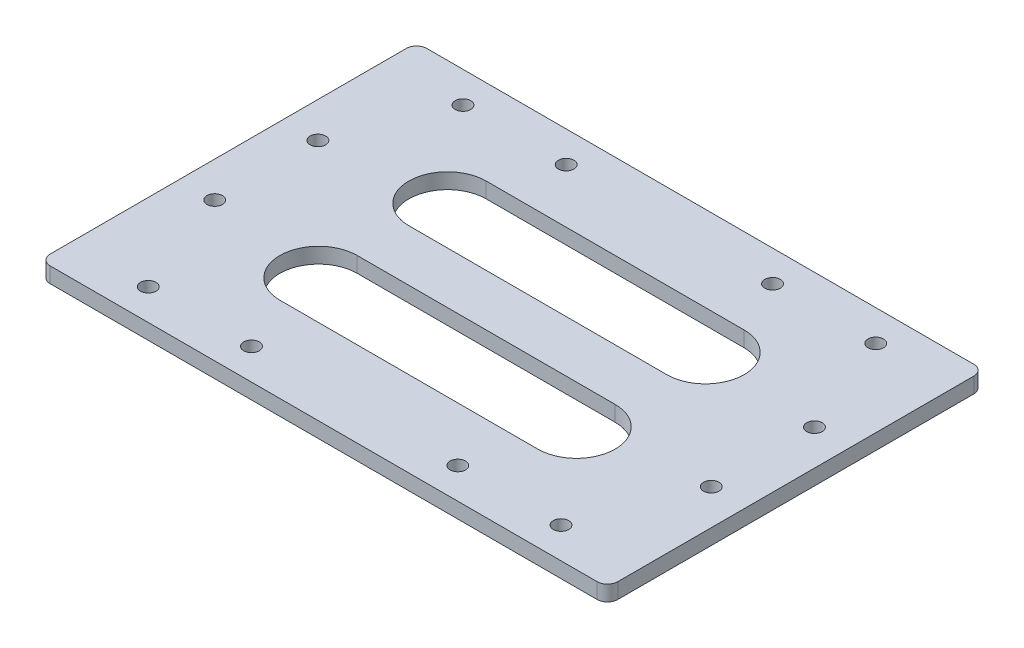
from build123d import *

# Parameters (mm, degrees)
SKETCH_1_W          = 110
SKETCH_1_H          = 73
SKETCH_1_R          = 1.5
EXTRUDE_1_DEPTH     = 3
CUT_EXTRUDE_1_DEPTH = 10
FILLET_1_R          = 2


with BuildPart() as part:
    # 草图1 → 凸台-拉伸1 (new body)
    with BuildSketch(Plane(origin=(0, 0, 0), x_dir=(1, 0, 0), z_dir=(0, 1, 0))):
        Rectangle(SKETCH_1_W, SKETCH_1_H)
        with Locations((-40, 30.5)):
            Circle(SKETCH_1_R, mode=Mode.SUBTRACT)
        with Locations((-20, 30.5)):
            Circle(SKETCH_1_R, mode=Mode.SUBTRACT)
        with Locations((-48.125, 10.5)):
            Circle(SKETCH_1_R, mode=Mode.SUBTRACT)
        with Locations((-48.125, -9.5)):
            Circle(SKETCH_1_R, mode=Mode.SUBTRACT)
        with Locations((48.125, -9.5)):
            Circle(SKETCH_1_R, mode=Mode.SUBTRACT)
        with Locations((48.125, 10.5)):
            Circle(SKETCH_1_R, mode=Mode.SUBTRACT)
        with Locations((20, 30.5)):
            Circle(SKETCH_1_R, mode=Mode.SUBTRACT)
        with Locations((40, 30.5)):
            Circle(SKETCH_1_R, mode=Mode.SUBTRACT)
        with Locations((40, -30.5)):
            Circle(SKETCH_1_R, mode=Mode.SUBTRACT)
        with Locations((20, -30.5)):
            Circle(SKETCH_1_R, mode=Mode.SUBTRACT)
        with Locations((-20, -30.5)):
            Circle(SKETCH_1_R, mode=Mode.SUBTRACT)
        with Locations((-40, -30.5)):
            Circle(SKETCH_1_R, mode=Mode.SUBTRACT)
    extrude(amount=EXTRUDE_1_DEPTH)

    # 草图2 → 切除-拉伸1 (cut)
    with BuildSketch(Plane(origin=(0, 3, 0), x_dir=(1, 0, 0), z_dir=(0, 1, 0))):
        with BuildLine():
            Line((-25, 20), (25, 20))
            ThreePointArc((25, 20), (32.5, 12.5), (25, 5))
            Line((25, 5), (-25, 5))
            ThreePointArc((-25, 5), (-32.5, 12.5), (-25, 20))
        make_face()
        with BuildLine():
            Line((-25, -20), (25, -20))
            ThreePointArc((25, -20), (32.5, -12.5), (25, -5))
            Line((25, -5), (-25, -5))
            ThreePointArc((-25, -5), (-32.5, -12.5), (-25, -20))
        make_face()
    extrude(amount=-CUT_EXTRUDE_1_DEPTH, mode=Mode.SUBTRACT)

    # 圆角1
    fillet_1_edges = [part.edges().sort_by_distance(p)[0] for p in [
        (55, 1.5, 36.5),
        (-55, 1.5, -36.5),
        (55, 1.5, -36.5),
        (-55, 1.5, 36.5),
    ]]
    fillet(fillet_1_edges, radius=FILLET_1_R)


solid = part.part
